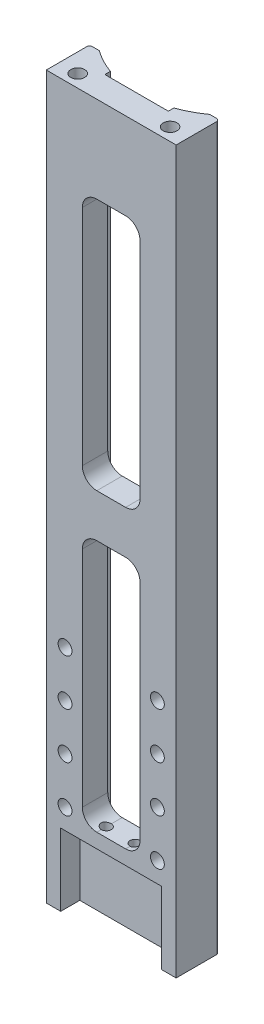
from build123d import *

# Parameters (mm, degrees)
RUNDUNG_DEPTH                    = 250
SKIZZE2_W                        = 22
SKIZZE2_H                        = 3.270726357
AUSSPARUNGLAUF_DEPTH             = 252.122480077
SKIZZE4_W                        = 20
SKIZZE4_H                        = 87.5
SCHNITT_LINEAR_AUSTRAGEN2_DEPTH  = 252.164667101
SKIZZE5_R                        = 2.4
SCHNITT_LINEAR_AUSTRAGEN4_DEPTH  = 6.4
SKIZZE6_R                        = 2.85
SCHNITT_LINEAR_AUSTRAGEN5_DEPTH  = 1
SKIZZE9_W                        = 35
SKIZZE9_H                        = 6.605082277
SCHNITT_LINEAR_AUSTRAGEN9_DEPTH  = 25
SCHNITT_LINEAR_AUSTRAGEN10_REACH = 228.247
SKIZZE12_R                       = 1.75
SKIZZE14_R                       = 2.4
SCHNITT_LINEAR_AUSTRAGEN11_DEPTH = 6.4
SKIZZE15_R                       = 2.9
SCHNITT_LINEAR_AUSTRAGEN12_DEPTH = 1.2
VERRUNDUNG1_R                    = 5
VERRUNDUNG2_R                    = 1


with BuildPart() as part:
    # Skizze1 → Rundung (new body)
    with BuildSketch(Plane(origin=(0, 0, 0), x_dir=(1, 0, 0), z_dir=(0, 1, 0))):
        with BuildLine():
            Line((-19.158288024, 7.5), (-22.5, 7.5))
            Line((-22.5, 7.5), (-22.5, -7.5))
            Line((-22.5, -7.5), (22.5, -7.5))
            Line((22.5, -7.5), (22.5, 7.5))
            Line((22.5, 7.5), (19.158288024, 7.5))
            ThreePointArc((19.158288024, 7.5), (0, 1.3), (-19.158288024, 7.5))
        make_face()
    extrude(amount=RUNDUNG_DEPTH)

    # Skizze2 → AussparungLauf (cut, through all)
    with BuildSketch(Plane(origin=(0, 250, 0), x_dir=(1, 0, 0), z_dir=(0, 1, 0))):
        with Locations((0, 2.935363178)):
            Rectangle(SKIZZE2_W, SKIZZE2_H)
    extrude(amount=-AUSSPARUNGLAUF_DEPTH, mode=Mode.SUBTRACT)

    # Skizze4 → Schnitt-Linear austragen2 (cut, through all)
    with BuildSketch(Plane(origin=(0, 0, -1.3), x_dir=(-1, 0, 0), z_dir=(0, 0, -1))):
        with Locations((0, 73.75)):
            Rectangle(SKIZZE4_W, SKIZZE4_H)
        with Locations((0, 176.25)):
            Rectangle(SKIZZE4_W, SKIZZE4_H)
    extrude(amount=-SCHNITT_LINEAR_AUSTRAGEN2_DEPTH, mode=Mode.SUBTRACT)

    # Skizze5 → Schnitt-Linear austragen4 (cut)
    with BuildSketch(Plane.XY.offset(7.5)):
        with Locations((-16, 32)):
            Circle(SKIZZE5_R)
        with Locations((16, 32)):
            Circle(SKIZZE5_R)
        with Locations((16, 48)):
            Circle(SKIZZE5_R)
        with Locations((16, 64)):
            Circle(SKIZZE5_R)
        with Locations((16, 80)):
            Circle(SKIZZE5_R)
        with Locations((-16, 48)):
            Circle(SKIZZE5_R)
        with Locations((-16, 64)):
            Circle(SKIZZE5_R)
        with Locations((-16, 80)):
            Circle(SKIZZE5_R)
    extrude(amount=-SCHNITT_LINEAR_AUSTRAGEN4_DEPTH, mode=Mode.SUBTRACT)

    # Skizze6 → Schnitt-Linear austragen5 (cut)
    with BuildSketch(Plane.XY.offset(1.1)):
        with Locations((-16, 32)):
            Circle(SKIZZE6_R)
        with Locations((16, 32)):
            Circle(SKIZZE6_R)
        with Locations((16, 48)):
            Circle(SKIZZE6_R)
        with Locations((16, 64)):
            Circle(SKIZZE6_R)
        with Locations((16, 80)):
            Circle(SKIZZE6_R)
        with Locations((-16, 48)):
            Circle(SKIZZE6_R)
        with Locations((-16, 64)):
            Circle(SKIZZE6_R)
        with Locations((-16, 80)):
            Circle(SKIZZE6_R)
    extrude(amount=-SCHNITT_LINEAR_AUSTRAGEN5_DEPTH, mode=Mode.SUBTRACT)

    # Skizze9 → Schnitt-Linear austragen9 (cut)
    with BuildSketch(Plane.XZ):
        with Locations((0, 4.197458862)):
            Rectangle(SKIZZE9_W, SKIZZE9_H)
    extrude(amount=-SCHNITT_LINEAR_AUSTRAGEN9_DEPTH, mode=Mode.SUBTRACT)

    # Skizze12 → Schnitt-Linear austragen10 (cut, up to next)
    with BuildSketch(Plane.XZ.offset(-25), mode=Mode.PRIVATE) as schnitt_linear_austragen10_sk1:
        with Locations(Location((-5, 4.197458861, 0), (0, 0, 270))):
            Circle(SKIZZE12_R)
    schnitt_linear_austragen10_tool1 = extrude(schnitt_linear_austragen10_sk1.sketch, amount=-SCHNITT_LINEAR_AUSTRAGEN10_REACH, mode=Mode.PRIVATE) & part.part
    # Skizze12 → Schnitt-Linear austragen10 (cut, up to next)
    with BuildSketch(Plane.XZ.offset(-25), mode=Mode.PRIVATE) as schnitt_linear_austragen10_sk2:
        with Locations(Location((5, 4.197458861, 0), (0, 0, 270))):
            Circle(SKIZZE12_R)
    schnitt_linear_austragen10_tool2 = extrude(schnitt_linear_austragen10_sk2.sketch, amount=-SCHNITT_LINEAR_AUSTRAGEN10_REACH, mode=Mode.PRIVATE) & part.part
    add(schnitt_linear_austragen10_tool1.solids().sort_by_distance((-5, 25, 4.197459))[0], mode=Mode.SUBTRACT)
    add(schnitt_linear_austragen10_tool2.solids().sort_by_distance((5, 25, 4.197459))[0], mode=Mode.SUBTRACT)

    # Skizze14 → Schnitt-Linear austragen11 (cut)
    with BuildSketch(Plane(origin=(0, 250, 0), x_dir=(1, 0, 0), z_dir=(0, 1, 0))):
        with Locations(Location((-16, -3.1, 0), (0, 0, 270))):
            Circle(SKIZZE14_R)
        with Locations(Location((16, -3.1, 0), (0, 0, 90))):
            Circle(SKIZZE14_R)
    extrude(amount=-SCHNITT_LINEAR_AUSTRAGEN11_DEPTH, mode=Mode.SUBTRACT)

    # Skizze15 → Schnitt-Linear austragen12 (cut)
    with BuildSketch(Plane(origin=(0, 243.6, 0), x_dir=(1, 0, 0), z_dir=(0, 1, 0))):
        with Locations(Location((-16, -3.1, 0), (0, 0, 270))):
            Circle(SKIZZE15_R)
        with Locations(Location((16, -3.1, 0), (0, 0, 90))):
            Circle(SKIZZE15_R)
    extrude(amount=-SCHNITT_LINEAR_AUSTRAGEN12_DEPTH, mode=Mode.SUBTRACT)

    # Verrundung1
    # the kernel refuses this fillet: 5 mm, written as the material it adds along each edge
    with BuildSketch(Plane(origin=(10, 132.5, -1.3), x_dir=(0, 1, 0), z_dir=(0, 0, 1)), Plane(origin=(-10, 132.5, -1.3), x_dir=(1, 0, 0), z_dir=(0, 0, 1))) as verrundung1_piece_1:
        with BuildLine():
            CenterArc((VERRUNDUNG1_R, VERRUNDUNG1_R), VERRUNDUNG1_R, 180, 90)
            Line((0, VERRUNDUNG1_R), (0, 0))
            Line((0, 0), (VERRUNDUNG1_R, 0))
        make_face()
    extrude(amount=8.8)
    with BuildSketch(Plane(origin=(10, 220, -1.3), x_dir=(0, -1, 0), z_dir=(0, 0, 1)), Plane(origin=(-10, 220, -1.3), x_dir=(1, 0, 0), z_dir=(0, 0, 1)), Plane(origin=(10, 117.5, -1.3), x_dir=(0, -1, 0), z_dir=(0, 0, 1)), Plane(origin=(-10, 117.5, -1.3), x_dir=(1, 0, 0), z_dir=(0, 0, 1))) as verrundung1_piece_2:
        with BuildLine():
            CenterArc((VERRUNDUNG1_R, -VERRUNDUNG1_R), VERRUNDUNG1_R, 90, 90)
            Line((0, -VERRUNDUNG1_R), (0, 0))
            Line((0, 0), (VERRUNDUNG1_R, 0))
        make_face()
    extrude(amount=8.8)
    with BuildSketch(Plane(origin=(10, 30, -1.3), x_dir=(0, 1, 0), z_dir=(0, 0, 1))) as verrundung1_piece_3_section:
        with BuildLine():
            CenterArc((VERRUNDUNG1_R, VERRUNDUNG1_R), VERRUNDUNG1_R, 180, 90)
            Line((0, VERRUNDUNG1_R), (0, 0))
            Line((0, 0), (VERRUNDUNG1_R, 0))
        make_face()
    verrundung1_piece_3 = extrude(amount=8.8, mode=Mode.PRIVATE)
    verrundung1_piece_3 = verrundung1_piece_3 - Plane(origin=(5, 31.149403534, 4.197458861), x_dir=(0, 0, -1), z_dir=(0, -1, 0)) * Cylinder(1.75, 38, mode=Mode.PRIVATE)
    add(verrundung1_piece_3)
    with BuildSketch(Plane(origin=(-10, 30, -1.3), x_dir=(1, 0, 0), z_dir=(0, 0, 1))) as verrundung1_piece_4_section:
        with BuildLine():
            CenterArc((VERRUNDUNG1_R, VERRUNDUNG1_R), VERRUNDUNG1_R, 180, 90)
            Line((0, VERRUNDUNG1_R), (0, 0))
            Line((0, 0), (VERRUNDUNG1_R, 0))
        make_face()
    verrundung1_piece_4 = extrude(amount=8.8, mode=Mode.PRIVATE)
    verrundung1_piece_4 = verrundung1_piece_4 - Plane(origin=(-5, 31.149403677, 4.197458861), x_dir=(0, 0, -1), z_dir=(0, -1, 0)) * Cylinder(1.75, 38, mode=Mode.PRIVATE)
    add(verrundung1_piece_4)

    # Verrundung2
    verrundung2_edges = [part.edges().sort_by_distance(p)[0] for p in [
        (22.5, 125, -7.5),
        (-22.5, 125, -7.5),
    ]]
    fillet(verrundung2_edges, radius=VERRUNDUNG2_R)


solid = part.part
